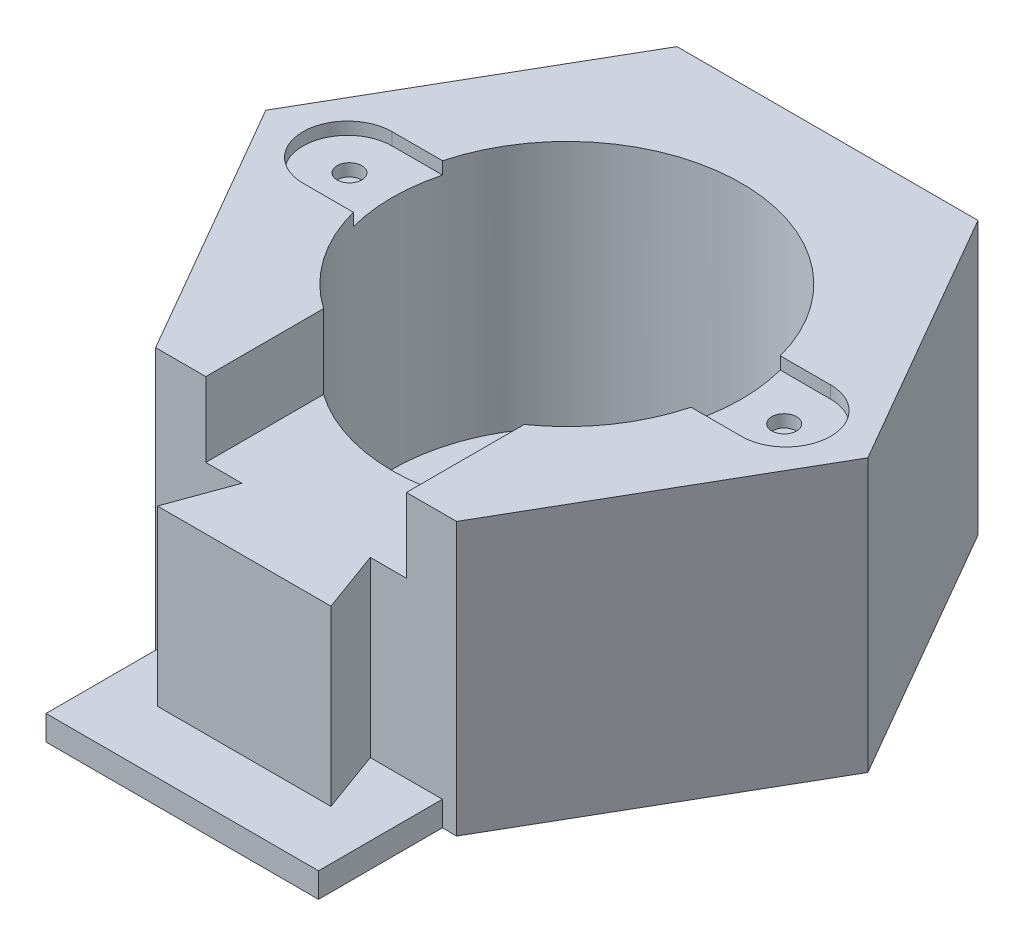
from build123d import *

# Parameters (mm, degrees)
SKETCH1_R             = 1
BOSS_EXTRUDE5_DEPTH   = 20
BOSS_EXTRUDE5_2_DEPTH = 20
BOSS_EXTRUDE6_DEPTH   = 2
SKETCH1_4_R           = 1
BOSS_EXTRUDE7_DEPTH   = 21
BOSS_EXTRUDE8_DEPTH   = 22
BOSS_EXTRUDE9_DEPTH   = 2
BOSS_EXTRUDE10_DEPTH  = 16


with BuildPart() as part:
    # Sketch1 → Boss-Extrude5 (new body)
    with BuildSketch(Plane(origin=(0, 0, 0), x_dir=(1, 0, 0), z_dir=(0, 1, 0))):
        with Locations((17.55, 0)):
            Circle(SKETCH1_R)
    extrude(amount=BOSS_EXTRUDE5_DEPTH)



with BuildPart() as body_2:
    # Sketch1 → Boss-Extrude5 2 (new body)
    with BuildSketch(Plane(origin=(0, 0, 0), x_dir=(1, 0, 0), z_dir=(0, 1, 0))):
        with Locations((-17.55, 0)):
            Circle(SKETCH1_R)
    extrude(amount=BOSS_EXTRUDE5_2_DEPTH)


with BuildPart() as body_3:
    # Sketch1<3> → Boss-Extrude6 (new body)
    with BuildSketch(Plane(origin=(0, 0, 0), x_dir=(1, 0, 0), z_dir=(0, 1, 0))):
        with BuildLine():
            ThreePointArc((13.632681321, 3.6), (0, 14.1), (-13.632681321, 3.6))
            ThreePointArc((-13.632681321, 3.6), (-14.1, 0), (-13.632681321, -3.6))
            ThreePointArc((-13.632681321, -3.6), (-11.569059796, -8.060201948), (-8.1, -11.541230437))
            ThreePointArc((-8.1, -11.541230437), (0, -14.1), (8.1, -11.541230437))
            ThreePointArc((8.1, -11.541230437), (11.569059796, -8.060201948), (13.632681321, -3.6))
            ThreePointArc((13.632681321, -3.6), (13.982682265, -1.81510239), (14.1, 0))
            ThreePointArc((14.1, 0), (13.982682265, 1.81510239), (13.632681321, 3.6))
        make_face()
    extrude(amount=BOSS_EXTRUDE6_DEPTH)


with BuildPart() as part_1:
    add(part.part)

    add(body_2.part)  # Boss-Extrude7 merges body 2

    add(body_3.part)  # Boss-Extrude7 merges body 3
    # Sketch1<4> → Boss-Extrude7 (add)
    # profile 1 of 2: a face of its own
    with BuildSketch(Plane(origin=(0, 0, 0), x_dir=(1, 0, 0), z_dir=(0, 1, 0))):
        with BuildLine():
            Line((-13.632681321, 3.6), (-17.7, 3.6))
            ThreePointArc((-17.7, 3.6), (-21.3, 0), (-17.7, -3.6))
            Line((-17.7, -3.6), (-13.632681321, -3.6))
            ThreePointArc((-13.632681321, -3.6), (-14.1, 0), (-13.632681321, 3.6))
        make_face()
        with Locations((-17.55, 0)):
            Circle(SKETCH1_4_R, mode=Mode.SUBTRACT)
    # profile 2 of 2: a face of its own
    with BuildSketch(Plane(origin=(0, 0, 0), x_dir=(1, 0, 0), z_dir=(0, 1, 0))):
        with BuildLine():
            Line((17.7, 3.6), (13.632681321, 3.6))
            ThreePointArc((13.632681321, 3.6), (14.1, 0), (13.632681321, -3.6))
            Line((13.632681321, -3.6), (17.7, -3.6))
            ThreePointArc((17.7, -3.6), (21.3, 0), (17.7, 3.6))
        make_face()
        with Locations((17.55, 0)):
            Circle(SKETCH1_4_R, mode=Mode.SUBTRACT)
    extrude(amount=BOSS_EXTRUDE7_DEPTH)

    # Sketch1<5> → Boss-Extrude8 (add)
    with BuildSketch(Plane(origin=(0, 0, 0), x_dir=(1, 0, 0), z_dir=(0, 1, 0))):
        with BuildLine():
            ThreePointArc((-17.7, -3.6), (-21.3, 0), (-17.7, 3.6))
            Line((-17.7, 3.6), (-13.632681321, 3.6))
            ThreePointArc((-13.632681321, 3.6), (0, 14.1), (13.632681321, 3.6))
            Line((13.632681321, 3.6), (17.7, 3.6))
            ThreePointArc((17.7, 3.6), (21.3, 0), (17.7, -3.6))
            Line((17.7, -3.6), (13.632681321, -3.6))
            ThreePointArc((13.632681321, -3.6), (11.569059796, -8.060201948), (8.1, -11.541230437))
            Line((8.1, -11.541230437), (8.1, -17.2))
            Line((8.1, -17.2), (8.1, -21.044417312))
            Line((8.1, -21.044417312), (11, -21.044417312))
            Line((11, -21.044417312), (12.15, -21.044417312))
            Line((12.15, -21.044417312), (24.3, 0))
            Line((24.3, 0), (12.15, 21.044417312))
            Line((12.15, 21.044417312), (-12.15, 21.044417312))
            Line((-12.15, 21.044417312), (-24.3, 0))
            Line((-24.3, 0), (-12.15, -21.044417312))
            Line((-12.15, -21.044417312), (-11, -21.044417312))
            Line((-11, -21.044417312), (-8.1, -21.044417312))
            Line((-8.1, -21.044417312), (-8.1, -17.2))
            Line((-8.1, -17.2), (-8.1, -11.541230437))
            ThreePointArc((-8.1, -11.541230437), (-11.569059796, -8.060201948), (-13.632681321, -3.6))
            Line((-13.632681321, -3.6), (-17.7, -3.6))
        make_face()
    extrude(amount=BOSS_EXTRUDE8_DEPTH)

    # Sketch1<7> → Boss-Extrude9 (add)
    with BuildSketch(Plane(origin=(0, 0, 0), x_dir=(1, 0, 0), z_dir=(0, 1, 0))):
        Polygon((-11, -31.044417312), (11, -31.044417312), (11, -21.044417312), (5.180666408, -21.044417312), (7.00051758, -26.044417312), (-7.00051758, -26.044417312), (-5.180666408, -21.044417312), (-11, -21.044417312), align=None)
    extrude(amount=BOSS_EXTRUDE9_DEPTH)

    # Sketch1<8> → Boss-Extrude10 (add)
    with BuildSketch(Plane(origin=(0, 0, 0), x_dir=(1, 0, 0), z_dir=(0, 1, 0))):
        with BuildLine():
            ThreePointArc((8.1, -11.541230437), (0, -14.1), (-8.1, -11.541230437))
            Line((-8.1, -11.541230437), (-8.1, -21.044417312))
            Line((-8.1, -21.044417312), (-5.180666408, -21.044417312))
            Line((-5.180666408, -21.044417312), (-7.00051758, -26.044417312))
            Line((-7.00051758, -26.044417312), (7.00051758, -26.044417312))
            Line((7.00051758, -26.044417312), (5.180666408, -21.044417312))
            Line((5.180666408, -21.044417312), (8.1, -21.044417312))
            Line((8.1, -21.044417312), (8.1, -11.541230437))
        make_face()
    extrude(amount=BOSS_EXTRUDE10_DEPTH)


solid = part_1.part
